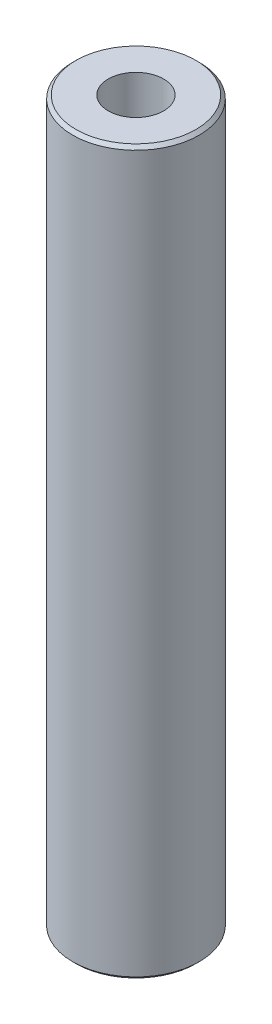
from build123d import *

# Parameters (mm, degrees)
SKETCH1_R           = 52.5
BOSS_EXTRUDE1_DEPTH = 600
SKETCH2_R           = 23.007325485
CUT_EXTRUDE1_DEPTH  = 605.576297914
CHAMFER1_SIZE       = 2.71603374


with BuildPart() as part:
    # Sketch1 → Boss-Extrude1 (new body)
    with BuildSketch(Plane(origin=(0, 0, 0), x_dir=(1, 0, 0), z_dir=(0, 1, 0))):
        Circle(SKETCH1_R)
    extrude(amount=BOSS_EXTRUDE1_DEPTH)

    # Sketch2 → Cut-Extrude1 (cut, through all)
    with BuildSketch(Plane(origin=(0, 0, 0), x_dir=(1, 0, 0), z_dir=(0, 1, 0))):
        Circle(SKETCH2_R)
    extrude(amount=CUT_EXTRUDE1_DEPTH, mode=Mode.SUBTRACT)

    # Chamfer1
    chamfer1_edges = [part.edges().sort_by_distance(p)[0] for p in [
        (-52.5, 600, 0),
        (-52.5, 0, 0),
    ]]
    chamfer(chamfer1_edges, length=CHAMFER1_SIZE)


solid = part.part
